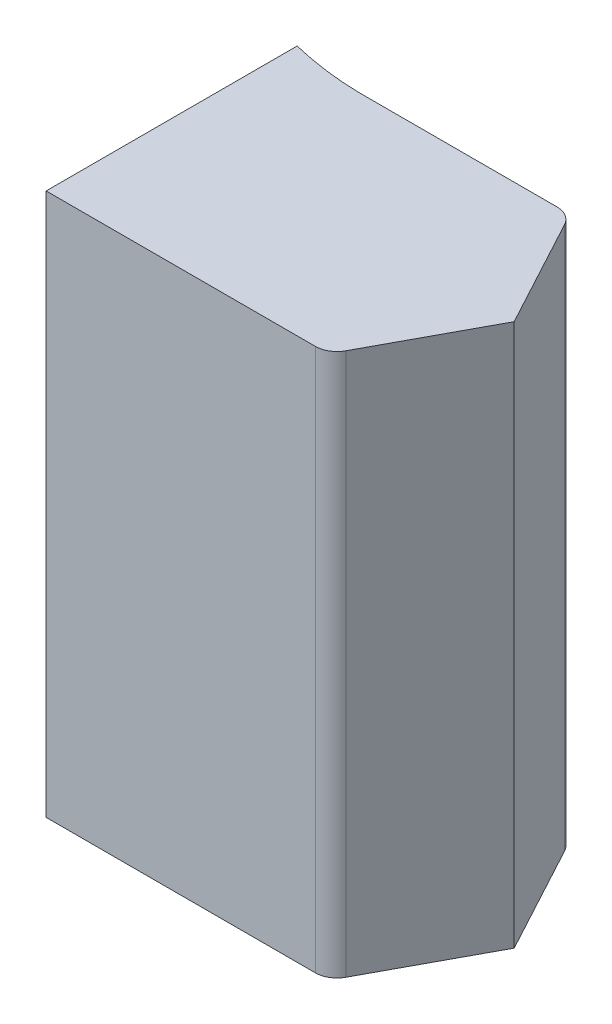
from build123d import *

# Parameters (mm, degrees)
BOSS_EXTRUDE2_START     = -97.202059813
BOSS_EXTRUDE2_OUTLINE_W = 10
BOSS_EXTRUDE2_OUTLINE_H = 250
BOSS_EXTRUDE2_DEPTH     = 97.202059813
BOSS_EXTRUDE3_DEPTH     = 250
FILLET3_R               = 10
SKETCH27_W              = 97.202059813
SKETCH27_H              = 91.324499606
BOSS_EXTRUDE4_DEPTH     = 250
SKETCH29_W              = 97.202059813
SKETCH29_H              = 91.324499606
BOSS_EXTRUDE5_DEPTH     = 30


# Read off the part's stored shape, not the designer's step: Boss-Extrude2
with BuildPart() as part:
    # Boss-Extrude2 outline → Boss-Extrude2 (new body)
    with BuildSketch(Plane.ZY.offset(-332.797940187).offset(BOSS_EXTRUDE2_START)):
        with Locations((60.662249803, 205)):
            Rectangle(BOSS_EXTRUDE2_OUTLINE_W, BOSS_EXTRUDE2_OUTLINE_H)
    boss_extrude2 = extrude(amount=BOSS_EXTRUDE2_DEPTH)

    # Sketch16 → Boss-Extrude3 (add)
    with BuildSketch(Plane(origin=(0, 80, 0), x_dir=(1, 0, 0), z_dir=(0, 1, 0))):
        Polygon((430, 45.662249803), (430, -65.662249803), (460, -10), align=None)
    extrude(amount=BOSS_EXTRUDE3_DEPTH)

    # Mirror1: Boss-Extrude2 across plane
    add(boss_extrude2.mirror(Plane.XY.offset(10)))

    # Fillet3
    fillet3_edges = [part.edges().sort_by_distance(p)[0] for p in [
        (430, 205, -45.662249803),
        (430, 205, 65.662249803),
    ]]
    fillet(fillet3_edges, radius=FILLET3_R)

    # Sketch27 → Boss-Extrude4 (add, through all)
    with BuildSketch(Plane(origin=(0, 330, 0), x_dir=(1, 0, 0), z_dir=(0, 1, 0))):
        with BuildLine():
            Line((300, 50), (300, -55.662249803))
            Line((300, -55.662249803), (300, -65.662249803))
            Line((300, -65.662249803), (332.797940187, -65.662249803))
            Line((332.797940187, -65.662249803), (424.029705603, -65.662249803))
            ThreePointArc((424.029705603, -65.662249803), (429.155896654, -64.24841107), (432.832566213, -60.406682865))
            Line((432.832566213, -60.406682865), (460, -10))
            Line((460, -10), (432.832566213, 40.406682865))
            ThreePointArc((432.832566213, 40.406682865), (429.155896654, 44.24841107), (424.029705603, 45.662249803))
            Line((424.029705603, 45.662249803), (332.797940187, 45.662249803))
            add(Edge.make_bspline(
                [(332.797940187, 45.662249803), (316.161422864, 46.017878572), (300, 50)],
                knots=[0, 0, 0, 1, 1, 1], degree=2))
        make_face()
        with Locations((381.398970093, -10)):
            Rectangle(SKETCH27_W, SKETCH27_H, mode=Mode.SUBTRACT)
    extrude(amount=-BOSS_EXTRUDE4_DEPTH)

    # Sketch29 → Boss-Extrude5 (add)
    with BuildSketch(Plane.XZ.offset(-80)):
        with Locations((381.398970093, 10)):
            Rectangle(SKETCH29_W, SKETCH29_H)
    boss_extrude5 = extrude(amount=-BOSS_EXTRUDE5_DEPTH)

    # Mirror2: Boss-Extrude5 across plane
    add(boss_extrude5.mirror(Plane.ZX.offset(205)))


with BuildPart() as body_2:
    # Mirror7: mirrored copy
    add(part.part.mirror(Plane.ZX.offset(-194.245032585)))


solid = body_2.part
